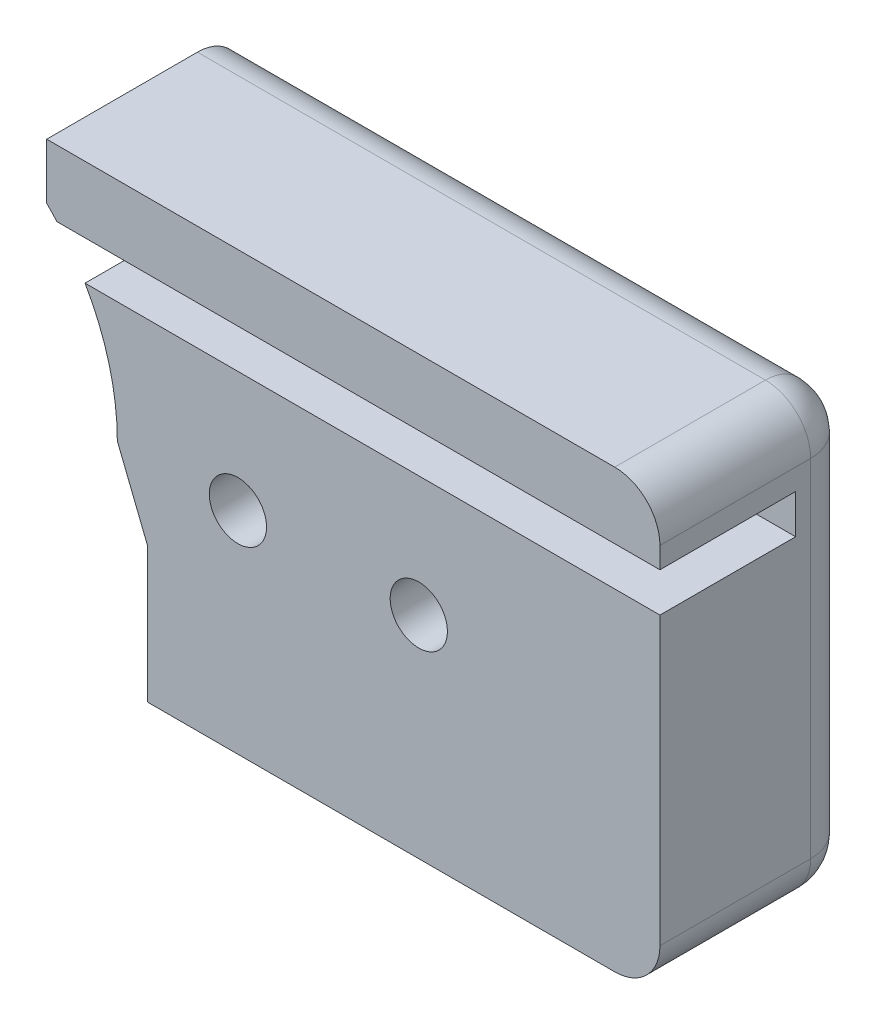
from build123d import *

# Parameters (mm, degrees)
BOSS_EXTRUDE1_DEPTH = 2
BOSS_EXTRUDE2_START = 4.5
BOSS_EXTRUDE2_DEPTH = 4.5
CUT_EXTRUDE1_DEPTH  = 4.5
BOSS_EXTRUDE3_DEPTH = 2.3
SKETCH9_R           = 2.1
CUT_EXTRUDE2_DEPTH  = 2.5
SKETCH10_R          = 2.5
BOSS_EXTRUDE4_DEPTH = 1.2
SKETCH11_R          = 0.95
CUT_EXTRUDE3_DEPTH  = 9.2
SKETCH12_R          = 2
CUT_EXTRUDE4_DEPTH  = 4.5
SKETCH14_W          = 20.343145751
SKETCH14_H          = 1.841510486
SKETCH14_W_2        = 17
SKETCH14_H_2        = 1.341637015
BOSS_EXTRUDE5_DEPTH = 1.2
FILLET1_R           = 1.5
SKETCH17_R          = 0.95
CUT_EXTRUDE5_DEPTH  = 3


# Read off the part's stored shape, not the designer's step: Boss-Extrude3
with BuildPart() as part:
    # Sketch5 → Boss-Extrude1 (new body)
    with BuildSketch(Plane.XY):
        with BuildLine():
            Line((8, 0), (9, -2.501635265))
            Line((9, -2.501635265), (9, -7.001635265))
            Line((9, -7.001635265), (26, -7.001635265))
            Line((26, -7.001635265), (26, 7.498364735))
            Line((26, 7.498364735), (5.656854249, 7.498364735))
            Line((5.656854249, 7.498364735), (5.656854249, 5.656854249))
            ThreePointArc((5.656854249, 5.656854249), (7.39103626, 3.061467459), (8, 0))
        make_face()
    extrude(amount=BOSS_EXTRUDE1_DEPTH)

    # Sketch6 → Boss-Extrude2 (add)
    with BuildSketch(Plane(origin=(0, 0, 0), x_dir=(-1, 0, 0), z_dir=(0, 0, -1)).offset(BOSS_EXTRUDE2_START)):
        with BuildLine():
            Line((-5.656854249, 7.498364735), (-5.656854249, 5.656854249))
            ThreePointArc((-5.656854249, 5.656854249), (-7.39103626, 3.061467459), (-8, 0))
            Line((-8, 0), (-9, -2.501635265))
            Line((-9, -2.501635265), (-9, -7.001635265))
            Line((-9, -7.001635265), (-26, -7.001635265))
            Line((-26, -7.001635265), (-26, 7.498364735))
            Line((-26, 7.498364735), (-5.656854249, 7.498364735))
        make_face()
    extrude(amount=-BOSS_EXTRUDE2_DEPTH)

    # Sketch7 → Cut-Extrude1 (cut)
    with BuildSketch(Plane(origin=(0, 0, -4.5), x_dir=(-1, 0, 0), z_dir=(0, 0, -1))):
        Polygon((-26, 5.298364735), (-2.738141148, 5.298364735), (-2.738141148, 3.998364735), (-29.849535112, 3.998364735), (-29.849535112, 5.298364735), align=None)
    extrude(amount=-CUT_EXTRUDE1_DEPTH, mode=Mode.SUBTRACT)

    # Boss-Extrude3 outline → Boss-Extrude3 (add)
    with BuildSketch(Plane(origin=(0, 0, -4.5), x_dir=(-1, 0, 0), z_dir=(0, 0, -1))):
        with BuildLine():
            Line((-9, -7.001635265), (-9, -5.65999825))
            Line((-9, -5.65999825), (0, -5.659997813))
            ThreePointArc((0, -5.659997813), (5.659997813, 0), (0, 5.659997813))
            Line((0, 5.659997813), (-5.656854249, 5.656854249))
            Line((-5.656854249, 5.656854249), (-5.656854249, 7.498364735))
            Line((-5.656854249, 7.498364735), (-26, 7.498364735))
            Line((-26, 7.498364735), (-26, -7.001635265))
            Line((-26, -7.001635265), (-9, -7.001635265))
        make_face()
    extrude(amount=BOSS_EXTRUDE3_DEPTH)

    # Sketch9 → Cut-Extrude2 (cut)
    with BuildSketch(Plane(origin=(0, 0, -6.8), x_dir=(-1, 0, 0), z_dir=(0, 0, -1))):
        Circle(SKETCH9_R)
    extrude(amount=-CUT_EXTRUDE2_DEPTH, mode=Mode.SUBTRACT)

    # Sketch10 → Boss-Extrude4 (add)
    with BuildSketch(Plane(origin=(0, 0, -6.8), x_dir=(-1, 0, 0), z_dir=(0, 0, -1))):
        with Locations((-12, 0)):
            Circle(SKETCH10_R)
        with Locations((-18, 0)):
            Circle(SKETCH10_R)
    extrude(amount=BOSS_EXTRUDE4_DEPTH)

    # Sketch11 → Cut-Extrude3 (cut)
    with BuildSketch(Plane(origin=(0, 0, -8), x_dir=(-1, 0, 0), z_dir=(0, 0, -1))):
        with Locations((-18, 0)):
            Circle(SKETCH11_R)
        with Locations((-12, 0)):
            Circle(SKETCH11_R)
    extrude(amount=-CUT_EXTRUDE3_DEPTH, mode=Mode.SUBTRACT)

    # Sketch12 → Cut-Extrude4 (cut)
    with BuildSketch(Plane.XY.offset(2)):
        with Locations((12, 0)):
            Circle(SKETCH12_R)
        with Locations((18, 0)):
            Circle(SKETCH12_R)
    extrude(amount=-CUT_EXTRUDE4_DEPTH, mode=Mode.SUBTRACT)

    # Sketch14 → Boss-Extrude5 (add)
    with BuildSketch(Plane(origin=(0, 0, -6.8), x_dir=(-1, 0, 0), z_dir=(0, 0, -1))):
        with Locations((-15.828427124, 6.577609492)):
            Rectangle(SKETCH14_W, SKETCH14_H)
        with Locations((-17.5, -6.330816758)):
            Rectangle(SKETCH14_W_2, SKETCH14_H_2)
    extrude(amount=BOSS_EXTRUDE5_DEPTH)

    # Fillet1
    # the kernel refuses this fillet: 1.5 mm, written as the material it takes off along each edge
    with BuildSketch(Plane(origin=(24.5, -5.501635265, 0.5), x_dir=(0, 0, 1), z_dir=(0, -1, 0))) as fillet1_piece_1_section:
        Polygon((0, 0), (FILLET1_R, 0), (FILLET1_R, -FILLET1_R), (0, -FILLET1_R), align=None)
    fillet1_piece_1 = extrude(amount=FILLET1_R, mode=Mode.PRIVATE)
    fillet1_piece_1 = fillet1_piece_1 - Plane(origin=(24.5, -5.501635265, 0.5), x_dir=(-0.7071067811865475, 0, -0.7071067811865475), z_dir=(0, -1, 0)) * Sphere(FILLET1_R, mode=Mode.PRIVATE)
    add(fillet1_piece_1, mode=Mode.SUBTRACT)
    with BuildSketch(Plane(origin=(24.5, 5.998364735, 0.5), x_dir=(0, 0, 1), z_dir=(0, 1, 0))) as fillet1_piece_2_section:
        Polygon((0, 0), (FILLET1_R, 0), (FILLET1_R, FILLET1_R), (0, FILLET1_R), align=None)
    fillet1_piece_2 = extrude(amount=FILLET1_R, mode=Mode.PRIVATE)
    fillet1_piece_2 = fillet1_piece_2 - Plane(origin=(24.5, 5.998364735, 0.5), x_dir=(-0.7071067811865475, 0, -0.7071067811865475), z_dir=(0, 1, 0)) * Sphere(FILLET1_R, mode=Mode.PRIVATE)
    add(fillet1_piece_2, mode=Mode.SUBTRACT)
    with BuildSketch(Plane(origin=(26, -5.501635265, 2), x_dir=(-1, 0, 0), z_dir=(0, 1, 0))) as fillet1_piece_3:
        with BuildLine():
            CenterArc((FILLET1_R, -FILLET1_R), FILLET1_R, 90, 90)
            Line((0, -FILLET1_R), (0, 0))
            Line((0, 0), (FILLET1_R, 0))
        make_face()
    extrude(amount=11.5, mode=Mode.SUBTRACT)
    with BuildSketch(Plane(origin=(26, -7.001635265, -4.5), x_dir=(-1, 0, 0), z_dir=(0, 0, 1))) as fillet1_piece_4:
        with BuildLine():
            CenterArc((FILLET1_R, -FILLET1_R), FILLET1_R, 90, 90)
            Line((0, -FILLET1_R), (0, 0))
            Line((0, 0), (FILLET1_R, 0))
        make_face()
    extrude(amount=5, mode=Mode.SUBTRACT)
    with BuildSketch(Plane(origin=(5.25, -7.001635265, 2), x_dir=(0, 1, 0), z_dir=(1, 0, 0))) as fillet1_piece_5:
        with BuildLine():
            CenterArc((FILLET1_R, -FILLET1_R), FILLET1_R, 90, 90)
            Line((0, -FILLET1_R), (0, 0))
            Line((0, 0), (FILLET1_R, 0))
        make_face()
    extrude(amount=19.25, mode=Mode.SUBTRACT)
    with BuildSketch(Plane(origin=(24.5, 7.498364735, 2), x_dir=(0, -1, 0), z_dir=(-1, 0, 0))) as fillet1_piece_6:
        with BuildLine():
            CenterArc((FILLET1_R, -FILLET1_R), FILLET1_R, 90, 90)
            Line((0, -FILLET1_R), (0, 0))
            Line((0, 0), (FILLET1_R, 0))
        make_face()
    extrude(amount=22.593145751, mode=Mode.SUBTRACT)
    with BuildSketch(Plane(origin=(26, 7.498364735, -4.5), x_dir=(-1, 0, 0), z_dir=(0, 0, 1))) as fillet1_piece_7:
        with BuildLine():
            CenterArc((FILLET1_R, FILLET1_R), FILLET1_R, 180, 90)
            Line((0, FILLET1_R), (0, 0))
            Line((0, 0), (FILLET1_R, 0))
        make_face()
    extrude(amount=5, mode=Mode.SUBTRACT)
    with BuildSketch(Plane(origin=(26, 7.498364735, -4.5), x_dir=(-1.0, -1.9174232572065026e-10, 0), z_dir=(0, 0, -1))) as fillet1_piece_8:
        with BuildLine():
            CenterArc((FILLET1_R, -FILLET1_R), FILLET1_R, 90.000000011, 90)
            Line((FILLET1_R * 1.9173522033e-10, -FILLET1_R), (0, 0))
            Line((0, 0), (FILLET1_R, 0))
        make_face()
    extrude(amount=2.3, mode=Mode.SUBTRACT)
    with BuildSketch(Plane(origin=(26, 7.498364735, -6.8), x_dir=(-1, 0, 0), z_dir=(0, 0, -1))) as fillet1_piece_9:
        with BuildLine():
            CenterArc((FILLET1_R, -FILLET1_R), FILLET1_R, 90, 90)
            Line((0, -FILLET1_R), (0, 0))
            Line((0, 0), (FILLET1_R, 0))
        make_face()
    extrude(amount=4.95, mode=Mode.SUBTRACT)
    with BuildSketch(Plane(origin=(26, -7.001635265, -4.5), x_dir=(-1.0, -1.9169850891861218e-10, 0), z_dir=(0, 0, -1))) as fillet1_piece_10:
        with BuildLine():
            CenterArc((FILLET1_R, FILLET1_R), FILLET1_R, 180.000000011, 90)
            Line((-FILLET1_R * 1.91707982785e-10, FILLET1_R), (0, 0))
            Line((0, 0), (FILLET1_R, 0))
        make_face()
    extrude(amount=2.3, mode=Mode.SUBTRACT)
    with BuildSketch(Plane(origin=(26, -7.001635265, -6.8), x_dir=(-1, 0, 0), z_dir=(0, 0, -1))) as fillet1_piece_11:
        with BuildLine():
            CenterArc((FILLET1_R, FILLET1_R), FILLET1_R, 180, 90)
            Line((0, FILLET1_R), (0, 0))
            Line((0, 0), (FILLET1_R, 0))
        make_face()
    extrude(amount=4.95, mode=Mode.SUBTRACT)

    # Sketch17 → Cut-Extrude5 (cut)
    with BuildSketch(Plane.XZ.offset(7.001635265)):
        with Locations((22, -1)):
            Circle(SKETCH17_R)
        with Locations((18, -1)):
            Circle(SKETCH17_R)
    extrude(amount=-CUT_EXTRUDE5_DEPTH, mode=Mode.SUBTRACT)

    # Mirror1: part across plane


with BuildPart() as part_1:
    add(part.part)
    add(part.part.mirror(Plane(origin=(0, 0, -8), x_dir=(1, 0, 0), z_dir=(0, 0, -1))))


with BuildPart() as body_2:
    # Split1: the piece on the far side of the plane
    add(part_1.part)
    split(bisect_by=Plane(origin=(0, 0, -8), x_dir=(-1, 0, 0), z_dir=(0, 0, -1)), keep=Keep.BOTTOM)


with BuildPart() as part_2:
    add(part_1.part)

    # Split1
    split(bisect_by=Plane(origin=(0, 0, -8), x_dir=(-1, 0, 0), z_dir=(0, 0, -1)), keep=Keep.TOP)


with BuildPart() as body_2_2:
    # Split2: the piece on the far side of the plane
    add(part_2.part)
    split(bisect_by=Plane(origin=(0, 0, -11.5), x_dir=(-1, 0, 0), z_dir=(0, 0, -1)), keep=Keep.BOTTOM)


with BuildPart() as part_3:
    add(part_2.part)

    # Split2
    split(bisect_by=Plane(origin=(0, 0, -11.5), x_dir=(-1, 0, 0), z_dir=(0, 0, -1)), keep=Keep.TOP)


solid = part_3.part
